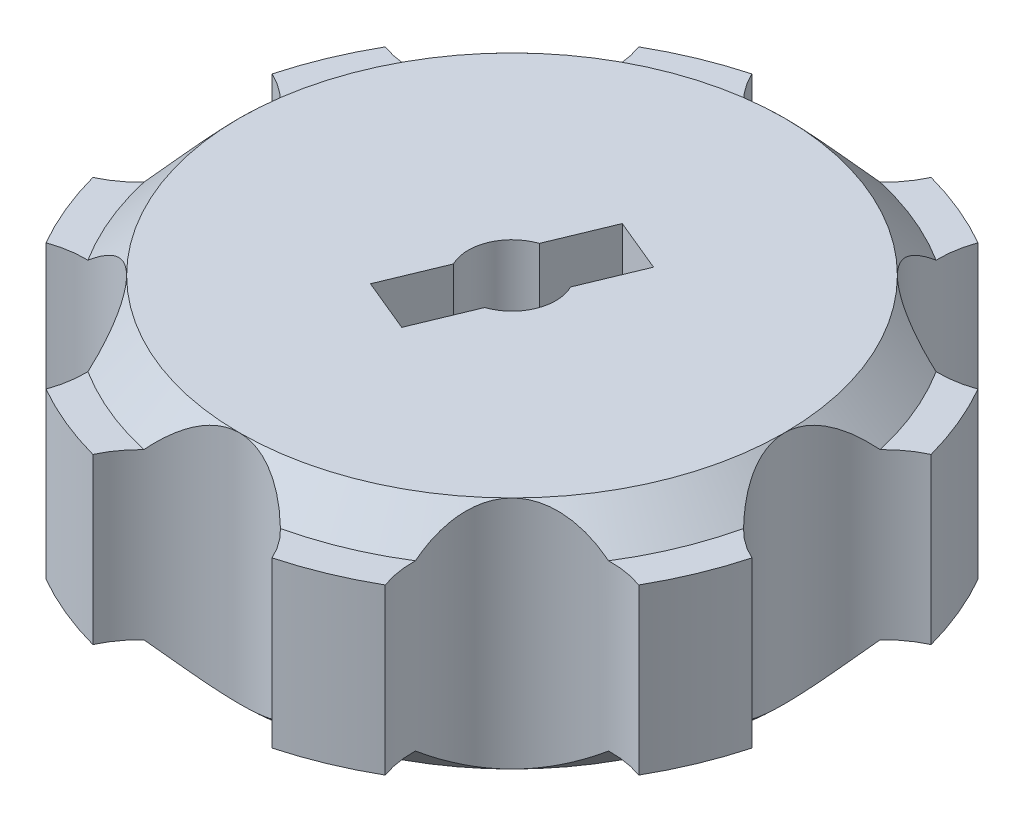
from build123d import *

# Parameters (mm, degrees)
SKETCH1_R           = 15.55551692
BOSS_EXTRUDE1_DEPTH = 9.4
BOSS_EXTRUDE2_START = 9.4
SKETCH1_4_R         = 15.55551692
BOSS_EXTRUDE2_DEPTH = 2
BOSS_EXTRUDE3_START = -2
SKETCH1_5_R         = 15.55551692
BOSS_EXTRUDE3_DEPTH = 2
CHAMFER2_SIZE       = 2
KEY_CUT_DEPTH       = 14


with BuildPart() as part:
    # Sketch1 → Boss-Extrude1 (new body)
    with BuildSketch(Plane(origin=(0, 0, 0), x_dir=(1, 0, 0), z_dir=(0, 1, 0))):
        with BuildLine():
            ThreePointArc((-16.916819633, -9.681614935), (-13.766406033, -9.47966445), (-10.999411499, -10.999411499))
            ThreePointArc((-10.999411499, -10.999411499), (-14.371423694, -5.952838621), (-15.55551692, -3.1e-08))
            ThreePointArc((-15.55551692, -3.1e-08), (-16.437454083, -3.031184056), (-18.807933452, -5.116062305))
            ThreePointArc((-18.807933452, -5.116062305), (-18.007652913, -7.459014063), (-16.916819633, -9.681614935))
        make_face()
        with BuildLine():
            ThreePointArc((-5.116062305, -18.807933452), (-3.031184038, -16.437454071), (1.1e-08, -15.55551692))
            ThreePointArc((1.1e-08, -15.55551692), (-5.952838602, -14.371423702), (-10.999411499, -10.999411499))
            ThreePointArc((-10.999411499, -10.999411499), (-9.47966445, -13.766406033), (-9.681614935, -16.916819633))
            ThreePointArc((-9.681614935, -16.916819633), (-7.459014063, -18.007652913), (-5.116062305, -18.807933452))
        make_face()
        with BuildLine():
            ThreePointArc((1.1e-08, -15.55551692), (3.031184048, -16.437454078), (5.116062305, -18.807933452))
            ThreePointArc((5.116062305, -18.807933452), (7.459014063, -18.007652913), (9.681614935, -16.916819633))
            ThreePointArc((9.681614935, -16.916819633), (9.47966445, -13.766406033), (10.999411499, -10.999411499))
            ThreePointArc((10.999411499, -10.999411499), (5.952838612, -14.371423698), (1.1e-08, -15.55551692))
        make_face()
        Circle(SKETCH1_R)
        with BuildLine():
            ThreePointArc((15.55551692, 0), (14.3714237, -5.952838607), (10.999411499, -10.999411499))
            ThreePointArc((10.999411499, -10.999411499), (13.766406033, -9.47966445), (16.916819633, -9.681614935))
            ThreePointArc((16.916819633, -9.681614935), (18.007652913, -7.459014063), (18.807933452, -5.116062305))
            ThreePointArc((18.807933452, -5.116062305), (16.437454074, -3.031184043), (15.55551692, 0))
        make_face()
        with BuildLine():
            ThreePointArc((10.999411479, 10.999411519), (14.371423695, 5.95283862), (15.55551692, 0))
            ThreePointArc((15.55551692, 0), (16.437454074, 3.031184043), (18.807933452, 5.116062305))
            ThreePointArc((18.807933452, 5.116062305), (18.007652913, 7.459014063), (16.916819633, 9.681614935))
            ThreePointArc((16.916819633, 9.681614935), (13.76640602, 9.479664453), (10.999411479, 10.999411519))
        make_face()
        with BuildLine():
            ThreePointArc((-2e-09, 15.55551692), (5.952838593, 14.371423706), (10.999411479, 10.999411519))
            ThreePointArc((10.999411479, 10.999411519), (9.479664447, 13.766406047), (9.681614935, 16.916819633))
            ThreePointArc((9.681614935, 16.916819633), (7.459014063, 18.007652913), (5.116062305, 18.807933452))
            ThreePointArc((5.116062305, 18.807933452), (3.031184042, 16.437454074), (-2e-09, 15.55551692))
        make_face()
        with BuildLine():
            ThreePointArc((-9.681614935, 16.916819633), (-9.479664448, 13.766406042), (-10.999411487, 10.999411511))
            ThreePointArc((-10.999411487, 10.999411511), (-5.9528386, 14.371423703), (-2e-09, 15.55551692))
            ThreePointArc((-2e-09, 15.55551692), (-3.031184044, 16.437454075), (-5.116062305, 18.807933452))
            ThreePointArc((-5.116062305, 18.807933452), (-7.459014063, 18.007652913), (-9.681614935, 16.916819633))
        make_face()
        with BuildLine():
            ThreePointArc((-18.807933452, 5.116062305), (-16.437454066, 3.03118403), (-15.55551692, -3.1e-08))
            ThreePointArc((-15.55551692, -3.1e-08), (-14.371423703, 5.952838601), (-10.999411487, 10.999411511))
            ThreePointArc((-10.999411487, 10.999411511), (-13.766406025, 9.479664452), (-16.916819633, 9.681614935))
            ThreePointArc((-16.916819633, 9.681614935), (-18.007652913, 7.459014063), (-18.807933452, 5.116062305))
        make_face()
    extrude(amount=BOSS_EXTRUDE1_DEPTH)

    # Sketch1<4> → Boss-Extrude2 (add)
    with BuildSketch(Plane(origin=(0, 0, 0), x_dir=(1, 0, 0), z_dir=(0, 1, 0)).offset(BOSS_EXTRUDE2_START)):
        with Locations(Location((0, 0, 0), (0, 0, 270))):
            Circle(SKETCH1_4_R)
    extrude(amount=BOSS_EXTRUDE2_DEPTH)

    # Sketch1<5> → Boss-Extrude3 (add)
    with BuildSketch(Plane(origin=(0, 0, 0), x_dir=(1, 0, 0), z_dir=(0, 1, 0)).offset(BOSS_EXTRUDE3_START)):
        with Locations(Location((0, 0, 0), (0, 0, 270))):
            Circle(SKETCH1_5_R)
    extrude(amount=BOSS_EXTRUDE3_DEPTH)

    # Chamfer2
    # the kernel refuses this chamfer: 2 mm, written as the material it adds along each edge
    with BuildSketch(Plane(origin=(0, 9.4, 0), x_dir=(-0.7071067819532597, 0, 0.7071067804198353), z_dir=(-0.7071067804198353, 0, -0.7071067819532597))) as chamfer2_piece_1_section:
        Polygon((15.55551692, CHAMFER2_SIZE), (15.55551692 + CHAMFER2_SIZE, 0), (15.55551692, 0), align=None)
    chamfer2_piece_1 = revolve(axis=Axis((0, 9.4, 0), (0, 1, 0)), revolution_arc=45.000000062, mode=Mode.PRIVATE)
    chamfer2_piece_1 = chamfer2_piece_1 - Plane(origin=(-14.994564813, 10.103766753, 14.994564813), x_dir=(-0.3402220920568066, 0, -0.9403451111567975), z_dir=(0, -1, 0)) * Cylinder(5.65, 71, mode=Mode.PRIVATE)
    chamfer2_piece_1 = chamfer2_piece_1 - Plane(origin=(0, 10.103766753, 21.20551692), x_dir=(-0.9054977531574303, 0, -0.42435105635174936), z_dir=(0, -1, 0)) * Cylinder(5.65, 71, mode=Mode.PRIVATE)
    add(chamfer2_piece_1)
    with BuildSketch(Plane(origin=(0, 9.4, 0), x_dir=(-1.0, 0, 2.0490157005346928e-09), z_dir=(-2.0490157005346928e-09, 0, -1.0))) as chamfer2_piece_2_section:
        Polygon((15.55551692, CHAMFER2_SIZE), (15.55551692 + CHAMFER2_SIZE, 0), (15.55551692, 0), align=None)
    chamfer2_piece_2 = revolve(axis=Axis((0, 9.4, 0), (0, 1, 0)), revolution_arc=44.99999982, mode=Mode.PRIVATE)
    chamfer2_piece_2 = chamfer2_piece_2 - Plane(origin=(-21.20551692, 10.103766743, 0), x_dir=(1.0, 0, 5.4411098439037235e-09), z_dir=(0, -1, 0)) * Cylinder(5.65, 71, mode=Mode.PRIVATE)
    chamfer2_piece_2 = chamfer2_piece_2 - Plane(origin=(-14.994564813, 10.103766743, 14.994564813), x_dir=(-0.3402220920568066, 0, -0.9403451111567975), z_dir=(0, -1, 0)) * Cylinder(5.65, 71, mode=Mode.PRIVATE)
    add(chamfer2_piece_2)
    with BuildSketch(Plane(origin=(0, 9.4, 0), x_dir=(-0.7071067817625238, 0, -0.7071067806105713), z_dir=(0.7071067806105713, 0, -0.7071067817625238))) as chamfer2_piece_3_section:
        Polygon((15.55551692 + CHAMFER2_SIZE, 0), (15.55551692, CHAMFER2_SIZE), (15.55551692, 0), align=None)
    chamfer2_piece_3 = revolve(axis=Axis((0, 9.4, 0), (0, 1, 0)), revolution_arc=45.000000071, mode=Mode.PRIVATE)
    chamfer2_piece_3 = chamfer2_piece_3 - Plane(origin=(-14.994564813, 10.103766886, -14.994564813), x_dir=(0.9403451111567979, 0, -0.34022209205680554), z_dir=(0, -1, 0)) * Cylinder(5.65, 71, mode=Mode.PRIVATE)
    chamfer2_piece_3 = chamfer2_piece_3 - Plane(origin=(-21.20551692, 10.103766886, 0), x_dir=(1.0, 0, 5.4411098439037235e-09), z_dir=(0, -1, 0)) * Cylinder(5.65, 71, mode=Mode.PRIVATE)
    add(chamfer2_piece_3)
    with BuildSketch(Plane(origin=(0, 9.4, 0), x_dir=(1.1417875063861984e-10, 0, -1.0), z_dir=(1.0, 0, 1.1417875063861984e-10))) as chamfer2_piece_4_section:
        Polygon((15.55551692 + CHAMFER2_SIZE, 0), (15.55551692, CHAMFER2_SIZE), (15.55551692, 0), align=None)
    chamfer2_piece_4 = revolve(axis=Axis((0, 9.4, 0), (0, 1, 0)), revolution_arc=45.000000053, mode=Mode.PRIVATE)
    chamfer2_piece_4 = chamfer2_piece_4 - Plane(origin=(-14.994564813, 10.103766753, -14.994564813), x_dir=(0.9403451111567979, 0, -0.34022209205680554), z_dir=(0, -1, 0)) * Cylinder(5.65, 71, mode=Mode.PRIVATE)
    chamfer2_piece_4 = chamfer2_piece_4 - Plane(origin=(0, 10.103766753, -21.20551692), x_dir=(0.9054977531574306, 0, 0.4243510563517486), z_dir=(0, -1, 0)) * Cylinder(5.65, 71, mode=Mode.PRIVATE)
    add(chamfer2_piece_4)
    with BuildSketch(Plane(origin=(0, 9.4, 0), x_dir=(0.7071067822725222, 0, -0.7071067801005728), z_dir=(0.7071067801005728, 0, 0.7071067822725222))) as chamfer2_piece_5_section:
        Polygon((15.55551692, CHAMFER2_SIZE), (15.55551692 + CHAMFER2_SIZE, 0), (15.55551692, 0), align=None)
    chamfer2_piece_5 = revolve(axis=Axis((0, 9.4, 0), (0, 1, 0)), revolution_arc=45.000000081, mode=Mode.PRIVATE)
    chamfer2_piece_5 = chamfer2_piece_5 - Plane(origin=(0, 10.103766753, -21.20551692), x_dir=(0.9054977531574306, 0, 0.4243510563517486), z_dir=(0, -1, 0)) * Cylinder(5.65, 71, mode=Mode.PRIVATE)
    chamfer2_piece_5 = chamfer2_piece_5 - Plane(origin=(14.994564813, 10.103766753, -14.994564813), x_dir=(0.3402220920568063, 0, 0.9403451111567976), z_dir=(0, -1, 0)) * Cylinder(5.65, 71, mode=Mode.PRIVATE)
    add(chamfer2_piece_5)
    with BuildSketch(Plane(origin=(0, 9.4, 0), x_dir=(1.0, 0, 4.268254867465012e-10), z_dir=(-4.268254867465012e-10, 0, 1.0))) as chamfer2_piece_6_section:
        Polygon((15.55551692, CHAMFER2_SIZE), (15.55551692 + CHAMFER2_SIZE, 0), (15.55551692, 0), align=None)
    chamfer2_piece_6 = revolve(axis=Axis((0, 9.4, 0), (0, 1, 0)), revolution_arc=44.999999936, mode=Mode.PRIVATE)
    chamfer2_piece_6 = chamfer2_piece_6 - Plane(origin=(14.994564813, 10.103766753, -14.994564813), x_dir=(0.3402220920568063, 0, 0.9403451111567976), z_dir=(0, -1, 0)) * Cylinder(5.65, 71, mode=Mode.PRIVATE)
    chamfer2_piece_6 = chamfer2_piece_6 - Plane(origin=(21.20551692, 10.103766753, 0), x_dir=(-0.42435105635174664, 0, 0.9054977531574315), z_dir=(0, -1, 0)) * Cylinder(5.65, 71, mode=Mode.PRIVATE)
    add(chamfer2_piece_6)
    with BuildSketch(Plane(origin=(0, 9.4, 0), x_dir=(0.7071067799459831, 0, 0.7071067824271119), z_dir=(-0.7071067824271119, 0, 0.7071067799459831))) as chamfer2_piece_7_section:
        Polygon((15.55551692, CHAMFER2_SIZE), (15.55551692 + CHAMFER2_SIZE, 0), (15.55551692, 0), align=None)
    chamfer2_piece_7 = revolve(axis=Axis((0, 9.4, 0), (0, 1, 0)), revolution_arc=45.000000076, mode=Mode.PRIVATE)
    chamfer2_piece_7 = chamfer2_piece_7 - Plane(origin=(14.994564813, 10.103766753, 14.994564813), x_dir=(-0.9403451111567976, 0, 0.34022209205680604), z_dir=(0, -1, 0)) * Cylinder(5.65, 71, mode=Mode.PRIVATE)
    chamfer2_piece_7 = chamfer2_piece_7 - Plane(origin=(21.20551692, 10.103766753, 0), x_dir=(-0.42435105635174664, 0, 0.9054977531574315), z_dir=(0, -1, 0)) * Cylinder(5.65, 71, mode=Mode.PRIVATE)
    add(chamfer2_piece_7)
    with BuildSketch(Plane(origin=(0, 9.4, 0), x_dir=(0, 0, 1), z_dir=(-1, 0, 0))) as chamfer2_piece_8_section:
        Polygon((15.55551692, CHAMFER2_SIZE), (15.55551692 + CHAMFER2_SIZE, 0), (15.55551692, 0), align=None)
    chamfer2_piece_8 = revolve(axis=Axis((0, 9.4, 0), (0, 1, 0)), revolution_arc=44.999999899, mode=Mode.PRIVATE)
    chamfer2_piece_8 = chamfer2_piece_8 - Plane(origin=(14.994564813, 10.103766753, 14.994564813), x_dir=(-0.9403451111567976, 0, 0.34022209205680604), z_dir=(0, -1, 0)) * Cylinder(5.65, 71, mode=Mode.PRIVATE)
    chamfer2_piece_8 = chamfer2_piece_8 - Plane(origin=(0, 10.103766753, 21.20551692), x_dir=(-0.9054977531574303, 0, -0.42435105635174936), z_dir=(0, -1, 0)) * Cylinder(5.65, 71, mode=Mode.PRIVATE)
    add(chamfer2_piece_8)
    with BuildSketch(Plane(origin=(0, 0, 0), x_dir=(-0.7071067819532592, 0, 0.707106780419836), z_dir=(-0.707106780419836, 0, -0.7071067819532592))) as chamfer2_piece_9_section:
        Polygon((15.55551692, -CHAMFER2_SIZE), (15.55551692 + CHAMFER2_SIZE, 0), (15.55551692, 0), align=None)
    chamfer2_piece_9 = revolve(axis=Axis((0, 0, 0), (0, 1, 0)), revolution_arc=45.000000062, mode=Mode.PRIVATE)
    chamfer2_piece_9 = chamfer2_piece_9 - Plane(origin=(-14.994564813, -0.703766753, 14.994564813), x_dir=(-0.3402220920568066, 0, -0.9403451111567975), z_dir=(0, -1, 0)) * Cylinder(5.65, 71, mode=Mode.PRIVATE)
    chamfer2_piece_9 = chamfer2_piece_9 - Plane(origin=(0, -0.703766753, 21.20551692), x_dir=(-0.9054977531574303, 0, -0.42435105635174936), z_dir=(0, -1, 0)) * Cylinder(5.65, 71, mode=Mode.PRIVATE)
    add(chamfer2_piece_9)
    with BuildSketch(Plane(origin=(0, 0, 0), x_dir=(-1.0, 0, 7.725603147000415e-10), z_dir=(-7.725603147000415e-10, 0, -1.0))) as chamfer2_piece_10_section:
        Polygon((15.55551692, -CHAMFER2_SIZE), (15.55551692 + CHAMFER2_SIZE, 0), (15.55551692, 0), align=None)
    chamfer2_piece_10 = revolve(axis=Axis((0, 0, 0), (0, 1, 0)), revolution_arc=44.999999894, mode=Mode.PRIVATE)
    chamfer2_piece_10 = chamfer2_piece_10 - Plane(origin=(-21.20551692, -0.703766743, 0), x_dir=(1.0, 0, 5.4411098439037235e-09), z_dir=(0, -1, 0)) * Cylinder(5.65, 71, mode=Mode.PRIVATE)
    chamfer2_piece_10 = chamfer2_piece_10 - Plane(origin=(-14.994564813, -0.703766743, 14.994564813), x_dir=(-0.3402220920568066, 0, -0.9403451111567975), z_dir=(0, -1, 0)) * Cylinder(5.65, 71, mode=Mode.PRIVATE)
    add(chamfer2_piece_10)
    with BuildSketch(Plane(origin=(0, 0, 0), x_dir=(-0.7071067817031288, 0, -0.7071067806699662), z_dir=(0.7071067806699662, 0, -0.7071067817031288))) as chamfer2_piece_11_section:
        Polygon((15.55551692 + CHAMFER2_SIZE, 0), (15.55551692, -CHAMFER2_SIZE), (15.55551692, 0), align=None)
    chamfer2_piece_11 = revolve(axis=Axis((0, 0, 0), (0, 1, 0)), revolution_arc=45.000000002, mode=Mode.PRIVATE)
    chamfer2_piece_11 = chamfer2_piece_11 - Plane(origin=(-14.994564813, -0.703766886, -14.994564813), x_dir=(0.9403451111567979, 0, -0.34022209205680554), z_dir=(0, -1, 0)) * Cylinder(5.65, 71, mode=Mode.PRIVATE)
    chamfer2_piece_11 = chamfer2_piece_11 - Plane(origin=(-21.20551692, -0.703766886, 0), x_dir=(1.0, 0, 5.4411098439037235e-09), z_dir=(0, -1, 0)) * Cylinder(5.65, 71, mode=Mode.PRIVATE)
    add(chamfer2_piece_11)
    with BuildSketch(Plane(origin=(0, 0, 0), x_dir=(-5.915567194248534e-10, 0, -1.0), z_dir=(1.0, 0, -5.915567194248534e-10))) as chamfer2_piece_12_section:
        Polygon((15.55551692 + CHAMFER2_SIZE, 0), (15.55551692, -CHAMFER2_SIZE), (15.55551692, 0), align=None)
    chamfer2_piece_12 = revolve(axis=Axis((0, 0, 0), (0, 1, 0)), revolution_arc=45.000000008, mode=Mode.PRIVATE)
    chamfer2_piece_12 = chamfer2_piece_12 - Plane(origin=(-14.994564813, -0.703766753, -14.994564813), x_dir=(0.9403451111567979, 0, -0.34022209205680554), z_dir=(0, -1, 0)) * Cylinder(5.65, 71, mode=Mode.PRIVATE)
    chamfer2_piece_12 = chamfer2_piece_12 - Plane(origin=(0, -0.703766753, -21.20551692), x_dir=(0.9054977531574306, 0, 0.4243510563517486), z_dir=(0, -1, 0)) * Cylinder(5.65, 71, mode=Mode.PRIVATE)
    add(chamfer2_piece_12)
    with BuildSketch(Plane(origin=(0, 0, 0), x_dir=(0.7071067803065033, 0, -0.7071067820665917), z_dir=(0.7071067820665917, 0, 0.7071067803065033))) as chamfer2_piece_13_section:
        Polygon((15.55551692, -CHAMFER2_SIZE), (15.55551692 + CHAMFER2_SIZE, 0), (15.55551692, 0), align=None)
    chamfer2_piece_13 = revolve(axis=Axis((0, 0, 0), (0, 1, 0)), revolution_arc=44.999999963, mode=Mode.PRIVATE)
    chamfer2_piece_13 = chamfer2_piece_13 - Plane(origin=(0, -0.703766753, -21.20551692), x_dir=(0.9054977531574306, 0, 0.4243510563517486), z_dir=(0, -1, 0)) * Cylinder(5.65, 71, mode=Mode.PRIVATE)
    chamfer2_piece_13 = chamfer2_piece_13 - Plane(origin=(14.994564813, -0.703766753, -14.994564813), x_dir=(0.3402220920568063, 0, 0.9403451111567976), z_dir=(0, -1, 0)) * Cylinder(5.65, 71, mode=Mode.PRIVATE)
    add(chamfer2_piece_13)
    with BuildSketch(Plane(origin=(0, 0, 0), x_dir=(1.0, 0, 2.989517751270151e-10), z_dir=(-2.989517751270151e-10, 0, 1.0))) as chamfer2_piece_14_section:
        Polygon((15.55551692, -CHAMFER2_SIZE), (15.55551692 + CHAMFER2_SIZE, 0), (15.55551692, 0), align=None)
    chamfer2_piece_14 = revolve(axis=Axis((0, 0, 0), (0, 1, 0)), revolution_arc=45.000000088, mode=Mode.PRIVATE)
    chamfer2_piece_14 = chamfer2_piece_14 - Plane(origin=(14.994564813, -0.703766753, -14.994564813), x_dir=(0.3402220920568063, 0, 0.9403451111567976), z_dir=(0, -1, 0)) * Cylinder(5.65, 71, mode=Mode.PRIVATE)
    chamfer2_piece_14 = chamfer2_piece_14 - Plane(origin=(21.20551692, -0.703766753, 0), x_dir=(-0.42435105635174664, 0, 0.9054977531574315), z_dir=(0, -1, 0)) * Cylinder(5.65, 71, mode=Mode.PRIVATE)
    add(chamfer2_piece_14)
    with BuildSketch(Plane(origin=(0, 0, 0), x_dir=(0.7071067811865478, 0, 0.7071067811865472), z_dir=(-0.7071067811865472, 0, 0.7071067811865478))) as chamfer2_piece_15_section:
        Polygon((15.55551692, -CHAMFER2_SIZE), (15.55551692 + CHAMFER2_SIZE, 0), (15.55551692, 0), align=None)
    chamfer2_piece_15 = revolve(axis=Axis((0, 0, 0), (0, 1, 0)), revolution_arc=44.999999983, mode=Mode.PRIVATE)
    chamfer2_piece_15 = chamfer2_piece_15 - Plane(origin=(14.994564813, -0.703766753, 14.994564813), x_dir=(-0.9403451111567976, 0, 0.34022209205680604), z_dir=(0, -1, 0)) * Cylinder(5.65, 71, mode=Mode.PRIVATE)
    chamfer2_piece_15 = chamfer2_piece_15 - Plane(origin=(21.20551692, -0.703766753, 0), x_dir=(-0.42435105635174664, 0, 0.9054977531574315), z_dir=(0, -1, 0)) * Cylinder(5.65, 71, mode=Mode.PRIVATE)
    add(chamfer2_piece_15)
    with BuildSketch(Plane(origin=(0, 0, 0), x_dir=(0, 0, 1), z_dir=(-1, 0, 0))) as chamfer2_piece_16_section:
        Polygon((15.55551692, -CHAMFER2_SIZE), (15.55551692 + CHAMFER2_SIZE, 0), (15.55551692, 0), align=None)
    chamfer2_piece_16 = revolve(axis=Axis((0, 0, 0), (0, 1, 0)), revolution_arc=45, mode=Mode.PRIVATE)
    chamfer2_piece_16 = chamfer2_piece_16 - Plane(origin=(14.994564813, -0.703766753, 14.994564813), x_dir=(-0.9403451111567976, 0, 0.34022209205680604), z_dir=(0, -1, 0)) * Cylinder(5.65, 71, mode=Mode.PRIVATE)
    chamfer2_piece_16 = chamfer2_piece_16 - Plane(origin=(0, -0.703766753, 21.20551692), x_dir=(-0.9054977531574303, 0, -0.42435105635174936), z_dir=(0, -1, 0)) * Cylinder(5.65, 71, mode=Mode.PRIVATE)
    add(chamfer2_piece_16)

    # Shaft Key → Key-Cut (cut)
    with BuildSketch(Plane(origin=(0, 11.4, 0), x_dir=(1, 0, 0), z_dir=(0, 1, 0))):
        with BuildLine():
            Line((0.805658984, -2.366624939), (-0.580357649, -5.712765092))
            Line((-0.580357649, -5.712765092), (-3.629160107, -4.449909765))
            Line((-3.629160107, -4.449909765), (-2.243143474, -1.103769612))
            ThreePointArc((-2.243143474, -1.103769612), (-2.309698831, 0.956708581), (-0.805658984, 2.366624939))
            Line((-0.805658984, 2.366624939), (0.580357649, 5.712765092))
            Line((0.580357649, 5.712765092), (3.629160107, 4.449909765))
            Line((3.629160107, 4.449909765), (2.243143474, 1.103769612))
            ThreePointArc((2.243143474, 1.103769612), (2.309698831, -0.956708581), (0.805658984, -2.366624939))
        make_face()
    extrude(amount=-KEY_CUT_DEPTH, mode=Mode.SUBTRACT)


solid = part.part
